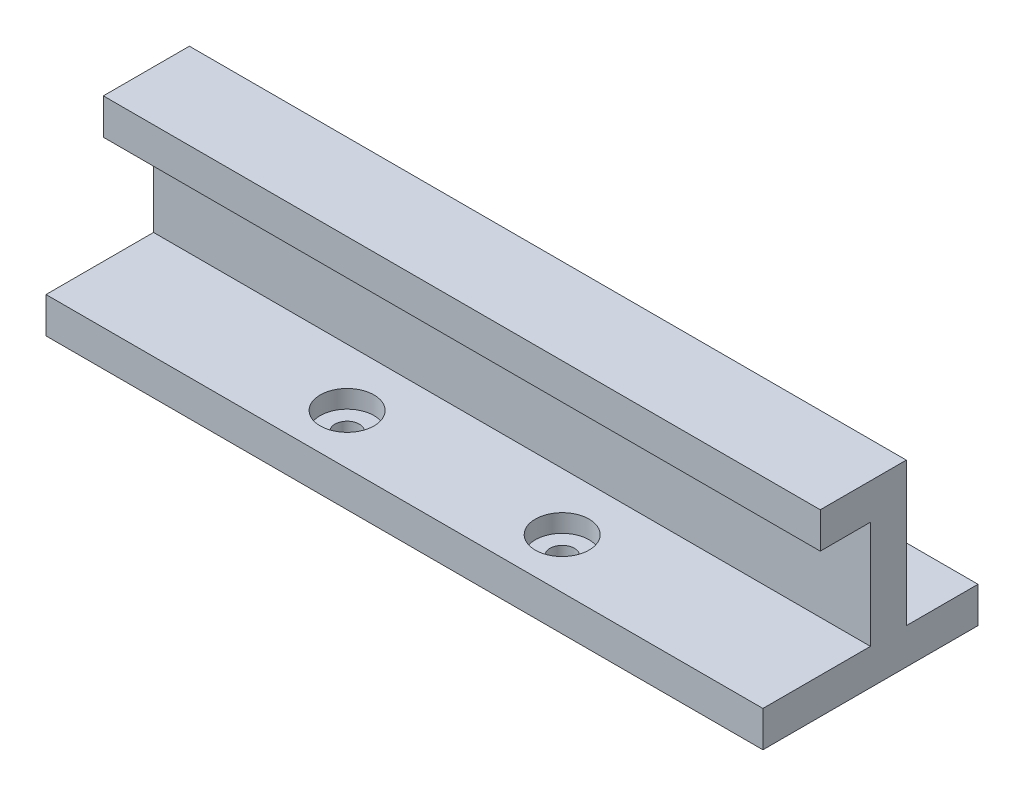
from build123d import *

# Parameters (mm, degrees)
SKETCH1_W                    = 100
SKETCH1_H                    = 20
SKETCH1_R                    = 1.7
EXTRUDE_BASE_DEPTH           = 5
SKETCH2_W                    = 100
SKETCH2_H                    = 5
EXTRUDE_VERTICAL_CLAMP_DEPTH = 20
SKETCH3_W                    = 100
SKETCH3_H                    = 5
EXTRUDE_CLAMP_ROOF_DEPTH     = 7
SKETCH5_W                    = 100
SKETCH5_H                    = 10
SKETCH5_R                    = 1.7
BOSS_EXTRUDE4_DEPTH          = 5
SKETCH4_R                    = 3.75
CUT_EXTRUDE1_DEPTH           = 2.5


with BuildPart() as part:
    # Sketch1 → Extrude-Base (new body)
    with BuildSketch(Plane(origin=(0, 0, 0), x_dir=(1, 0, 0), z_dir=(0, 1, 0))):
        with Locations((50, 10)):
            Rectangle(SKETCH1_W, SKETCH1_H)
        with Locations((35, 7)):
            Circle(SKETCH1_R, mode=Mode.SUBTRACT)
        with Locations((65, 7)):
            Circle(SKETCH1_R, mode=Mode.SUBTRACT)
    extrude(amount=EXTRUDE_BASE_DEPTH)

    # Sketch2 → Extrude-Vertical clamp (add)
    with BuildSketch(Plane(origin=(0, 5, 0), x_dir=(1, 0, 0), z_dir=(0, 1, 0))):
        with Locations((50, 17.5)):
            Rectangle(SKETCH2_W, SKETCH2_H)
    extrude(amount=EXTRUDE_VERTICAL_CLAMP_DEPTH)

    # Sketch3 → Extrude-Clamp Roof (add)
    with BuildSketch(Plane.XY.offset(-15)):
        with Locations((50, 22.5)):
            Rectangle(SKETCH3_W, SKETCH3_H)
    extrude(amount=EXTRUDE_CLAMP_ROOF_DEPTH)

    # Sketch5 → Boss-Extrude4 (add)
    with BuildSketch(Plane(origin=(0, 0, 0), x_dir=(1, 0, 0), z_dir=(0, 1, 0))):
        with Locations((50, 25)):
            Rectangle(SKETCH5_W, SKETCH5_H)
        with Locations((70, 25)):
            Circle(SKETCH5_R, mode=Mode.SUBTRACT)
        with Locations((30, 25)):
            Circle(SKETCH5_R, mode=Mode.SUBTRACT)
    extrude(amount=BOSS_EXTRUDE4_DEPTH)

    # Sketch4 → Cut-Extrude1 (cut)
    with BuildSketch(Plane(origin=(0, 5, 0), x_dir=(1, 0, 0), z_dir=(0, 1, 0))):
        with Locations((35, 7)):
            Circle(SKETCH4_R)
        with Locations((65, 7)):
            Circle(SKETCH4_R)
        with Locations((30, 25)):
            Circle(SKETCH4_R)
        with Locations((70, 25)):
            Circle(SKETCH4_R)
    extrude(amount=-CUT_EXTRUDE1_DEPTH, mode=Mode.SUBTRACT)


solid = part.part
